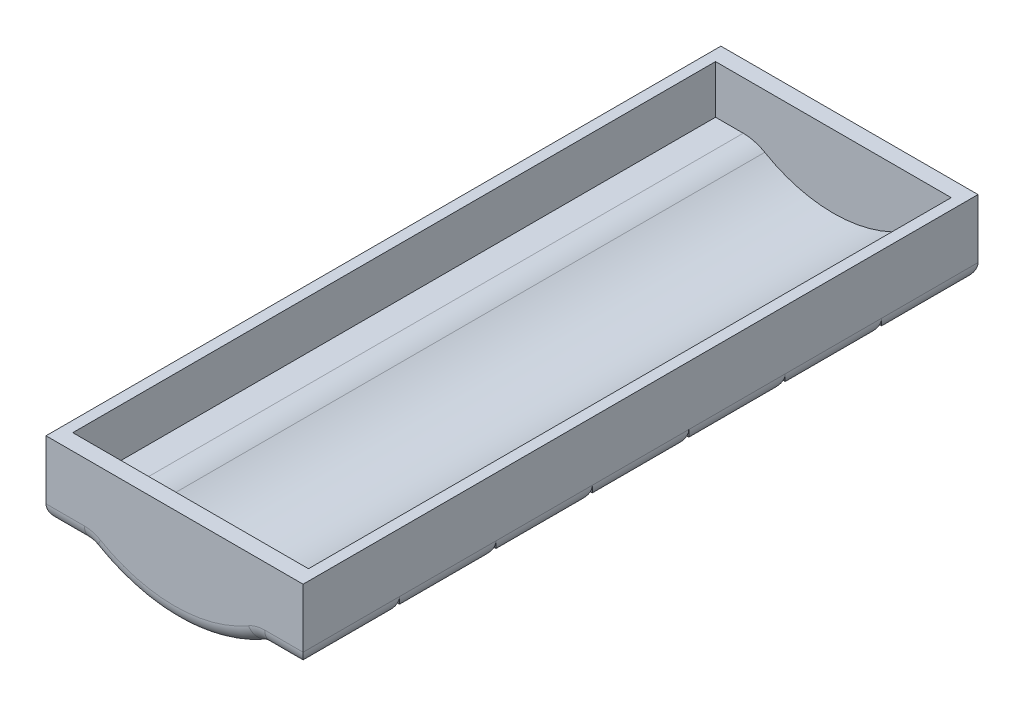
from build123d import *

# Parameters (mm, degrees)
BOSS_EXTRUDE1_DEPTH = 90
FILLET1_R           = 15
CUT_EXTRUDE1_START  = -15
CUT_EXTRUDE1_DEPTH  = 600


with BuildPart() as part:
    # Sketch1 → Boss-Extrude1 (new body)
    with BuildSketch(Plane.XY):
        with BuildLine():
            Line((-120, 0), (120, 0))
            Line((120, 0), (120, -70))
            Line((120, -70), (80, -70))
            ThreePointArc((80, -70), (0, -92.643375225), (-80, -70))
            Line((-80, -70), (-120, -70))
            Line((-120, -70), (-120, 0))
        make_face()
    extrude(amount=-BOSS_EXTRUDE1_DEPTH)

    # Fillet1
    fillet1_edges = [part.edges().sort_by_distance(p)[0] for p in [
        (-120, -70, -45),
        (-80, -70, -45),
        (80, -70, -45),
        (120, -70, -45),
        (100, -70, -90),
        (0, -92.643375225, -90),
        (-100, -70, -90),
        (-100, -70, 0),
        (0, -92.643375225, 0),
        (100, -70, 0),
    ]]
    fillet(fillet1_edges, radius=FILLET1_R)


with BuildPart() as body_2:
    # Body-Move/Copy1: read off the stored shape, not the designer's step
    # Body-Move/Copy1: copy of part
    add(part.part.moved(Location((0, 0, -540))))


with BuildPart() as body_3:
    # Body-Move_Copy1 2: copy of part
    add(part.part.moved(Location((0, 0, -450))))


with BuildPart() as body_4:
    # Body-Move_Copy1 3: copy of part
    add(part.part.moved(Location((0, 0, -360))))


with BuildPart() as body_5:
    # Body-Move_Copy1 4: copy of part
    add(part.part.moved(Location((0, 0, -270))))


with BuildPart() as body_6:
    # Body-Move_Copy1 5: copy of part
    add(part.part.moved(Location((0, 0, -180))))


with BuildPart() as body_7:
    # Body-Move_Copy1 6: copy of part
    add(part.part.moved(Location((0, 0, -90))))


with BuildPart() as part_1:
    add(part.part)

    # Combine1: union body 7, body 6, body 5, body 4, body 3, body 2
    add(body_7.part)
    add(body_6.part)
    add(body_5.part)
    add(body_4.part)
    add(body_3.part)
    add(body_2.part)

    # Sketch2 → Cut-Extrude1 (cut)
    with BuildSketch(Plane(origin=(0, 0, -630), x_dir=(-1, 0, 0), z_dir=(0, 0, -1)).offset(CUT_EXTRUDE1_START)):
        with BuildLine():
            Line((-110, -10), (-110, 0))
            Line((-110, 0), (110, 0))
            Line((110, 0), (110, -10))
            Line((110, -10), (110, -45))
            Line((110, -45), (84.138583639, -45))
            ThreePointArc((84.138583639, -45), (73.743634299, -46.374295758), (64.062971697, -50.402748589))
            ThreePointArc((64.062971697, -50.402748589), (0, -67.643375225), (-64.062971697, -50.402748589))
            ThreePointArc((-64.062971697, -50.402748589), (-73.743634299, -46.374295758), (-84.138583639, -45))
            Line((-84.138583639, -45), (-110, -45))
            Line((-110, -45), (-110, -10))
        make_face()
    extrude(amount=-CUT_EXTRUDE1_DEPTH, mode=Mode.SUBTRACT)


solid = part_1.part
